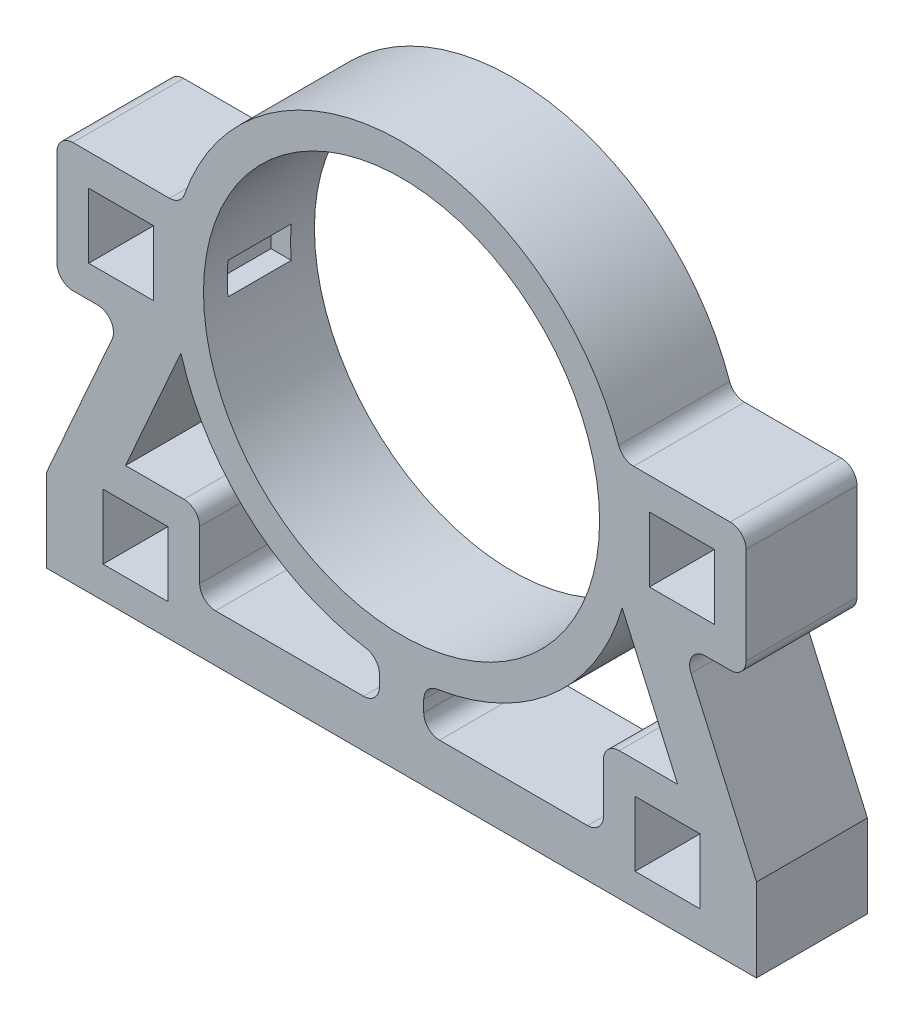
from build123d import *

# Parameters (mm, degrees)
SKETCH1_R           = 62.5
SKETCH1_W           = 20.5
SKETCH1_H           = 20.5
BOSS_EXTRUDE1_DEPTH = 35
FILLET2_R           = 5
SKETCH2_W           = 20
SKETCH2_H           = 10
CUT_EXTRUDE2_DEPTH  = 7
SKETCH3_W           = 20
SKETCH3_H           = 10
CUT_EXTRUDE3_DEPTH  = 7
SKETCH4_W           = 35
SKETCH4_H           = 26.243564279
CUT_EXTRUDE4_DEPTH  = 5
SKETCH5_W           = 35
SKETCH5_H           = 26.24
CUT_EXTRUDE5_DEPTH  = 5


with BuildPart() as part:
    # Sketch1 → Boss-Extrude1 (new body)
    with BuildSketch(Plane.XY):
        with BuildLine():
            Line((-69.594654141, 20.318319688), (-108.734784021, 20.318319688))
            Line((-108.734784021, 20.318319688), (-108.734784021, -20.181680312))
            Line((-108.734784021, -20.181680312), (-88.226517383, -20.181680312))
            Line((-88.226517383, -20.181680312), (-117, -85.161277705))
            Line((-117, -85.161277705), (-117, -100.161277705))
            Line((-117, -100.161277705), (117, -100.161277705))
            Line((117, -100.161277705), (117, -85.161277705))
            Line((117, -85.161277705), (88.226517383, -20.181680312))
            Line((88.226517383, -20.181680312), (108.734784021, -20.181680312))
            Line((108.734784021, -20.181680312), (108.734784021, 20.318319688))
            Line((108.734784021, 20.318319688), (69.594654141, 20.318319688))
            ThreePointArc((69.594654141, 20.318319688), (0, 72.5), (-69.594654141, 20.318319688))
        make_face()
        with BuildLine():
            Line((7, -85.161277705), (7, -72.161277705))
            ThreePointArc((7, -72.161277705), (46.29986484, -55.79043391), (69.634400836, -20.181680312))
            Line((69.634400836, -20.181680312), (87.116280609, -59.661277705))
            Line((87.116280609, -59.661277705), (63.708397156, -59.661277705))
            Line((63.708397156, -59.661277705), (63.708397156, -85.161277705))
            Line((63.708397156, -85.161277705), (7, -85.161277705))
        make_face(mode=Mode.SUBTRACT)
        with BuildLine():
            Line((-7, -72.161277705), (-7, -85.161277705))
            Line((-7, -85.161277705), (-63.708397156, -85.161277705))
            Line((-63.708397156, -85.161277705), (-63.708397156, -59.661277705))
            Line((-63.708397156, -59.661277705), (-87.116280609, -59.661277705))
            Line((-87.116280609, -59.661277705), (-69.634400836, -20.181680312))
            ThreePointArc((-69.634400836, -20.181680312), (-46.29986484, -55.79043391), (-7, -72.161277705))
        make_face(mode=Mode.SUBTRACT)
        Circle(SKETCH1_R, mode=Mode.SUBTRACT)
        with Locations((83.958397156, -79.911277705)):
            Rectangle(SKETCH1_W, SKETCH1_H, mode=Mode.SUBTRACT)
        with Locations((-83.958397156, -79.911277705)):
            Rectangle(SKETCH1_W, SKETCH1_H, mode=Mode.SUBTRACT)
        with Locations((-88.484784021, 0.068319688)):
            Rectangle(SKETCH1_W, SKETCH1_H, mode=Mode.SUBTRACT)
        with Locations((88.484784021, 0.068319688)):
            Rectangle(SKETCH1_W, SKETCH1_H, mode=Mode.SUBTRACT)
    extrude(amount=BOSS_EXTRUDE1_DEPTH)

    # Fillet2
    fillet2_edges = [part.edges().sort_by_distance(p)[0] for p in [
        (-108.734784021, 20.318319688, 17.5),
        (-69.594654141, 20.318319688, 17.5),
        (-88.226517383, -20.181680312, 17.5),
        (-108.734784021, -20.181680312, 17.5),
        (-63.708397156, -85.161277705, 17.5),
        (-63.708397156, -59.661277705, 17.5),
        (7, -85.161277705, 17.5),
        (7, -72.161277705, 17.5),
        (-7, -85.161277705, 17.5),
        (-7, -72.161277705, 17.5),
        (63.708397156, -85.161277705, 17.5),
        (63.708397156, -59.661277705, 17.5),
        (88.226517383, -20.181680312, 17.5),
        (108.734784021, -20.181680312, 17.5),
        (69.594654141, 20.318319688, 17.5),
        (108.734784021, 20.318319688, 17.5),
    ]]
    fillet(fillet2_edges, radius=FILLET2_R)

    # Sketch2 → Cut-Extrude2 (cut)
    with BuildSketch(Plane(origin=(61.7, 0, 0), x_dir=(0, 0, -1), z_dir=(1, 0, 0))):
        with Locations((-17.5, 0.068319688)):
            Rectangle(SKETCH2_W, SKETCH2_H)
    extrude(amount=CUT_EXTRUDE2_DEPTH, mode=Mode.SUBTRACT)

    # Sketch3 → Cut-Extrude3 (cut)
    with BuildSketch(Plane(origin=(-61.7, 0, 0), x_dir=(0, 0, -1), z_dir=(1, 0, 0))):
        with Locations((-17.5, 0.068319688)):
            Rectangle(SKETCH3_W, SKETCH3_H)
    extrude(amount=-CUT_EXTRUDE3_DEPTH, mode=Mode.SUBTRACT)

    # Sketch4 → Cut-Extrude4 (cut)
    with BuildSketch(Plane(origin=(117, 0, 0), x_dir=(0, 0, -1), z_dir=(1, 0, 0))):
        with Locations((-17.5, -87.039495566)):
            Rectangle(SKETCH4_W, SKETCH4_H)
    extrude(amount=-CUT_EXTRUDE4_DEPTH, mode=Mode.SUBTRACT)

    # Sketch5 → Cut-Extrude5 (cut)
    with BuildSketch(Plane.ZY.offset(117)):
        with Locations((17.5, -87.041277705)):
            Rectangle(SKETCH5_W, SKETCH5_H)
    extrude(amount=-CUT_EXTRUDE5_DEPTH, mode=Mode.SUBTRACT)


solid = part.part
